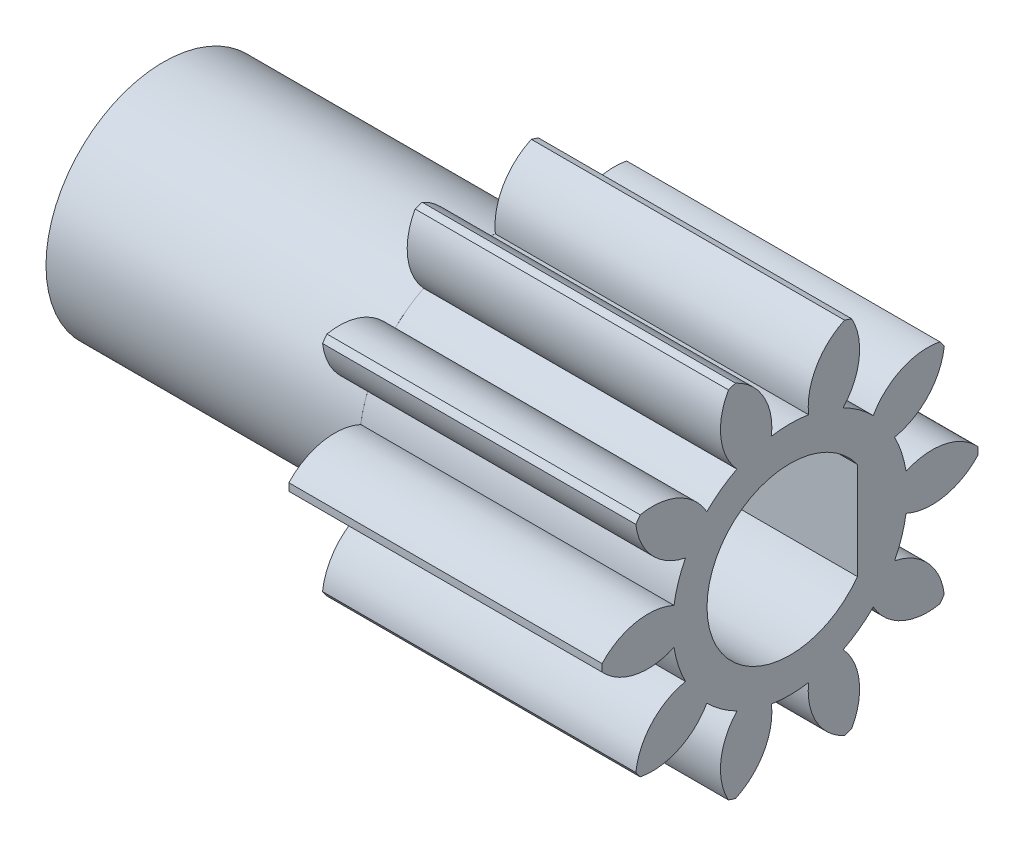
from build123d import *

# Parameters (mm, degrees)
BASPROSKE_W                  = 10
BASPROSKE_H                  = 6
TOOTHCUT_DEPTH               = 14.114877049
TEETHCUTS_COUNT              = 10
TEETHCUTS_ANGLE              = 324
BORSKE_R                     = 0.4
BORE_DEPTH                   = 50.0000508
CROQUIS1_R                   = 3.75
SALIENTE_EXTRUIR1_DEPTH      = 10
TALADRO_DE_MARGEN_PARA_M51_D = 5.3
SALIENTE_EXTRUIR2_DEPTH      = 10


with BuildPart() as part:
    # BasProSke → Base-Revolve (revolve)
    with BuildSketch(Plane(origin=(0, 0, 0), x_dir=(1, 0, 0), z_dir=(0, 1, 0))):
        with Locations((5, 3)):
            Rectangle(BASPROSKE_W, BASPROSKE_H)
    revolve(axis=Axis((-10, 0, 0), (1, 0, 0)))

    # TooCutSke → ToothCut (cut, through all)
    with BuildSketch(Plane(origin=(0, 0, 0), x_dir=(0, 0, -1), z_dir=(1, 0, 0))):
        with BuildLine():
            ThreePointArc((0.59278292, 3.701838653), (0, 3.749), (-0.59278292, 3.701838653))
            ThreePointArc((-0.59278292, 3.701838653), (-0.846593509, 4.924114224), (-1.775771316, 5.757784417))
            ThreePointArc((-1.775771316, 5.757784417), (0, 6.0254), (1.775771316, 5.757784417))
            ThreePointArc((1.775771316, 5.757784417), (0.846593509, 4.924114224), (0.59278292, 3.701838653))
        make_face()
    toothcut = extrude(amount=TOOTHCUT_DEPTH, mode=Mode.SUBTRACT)

    # TeethCuts: ToothCut ×10 about axis
    teethcuts_axis = Axis((-10, 0, 0), (1, 0, 0))
    for i in range(1, TEETHCUTS_COUNT):
        add(toothcut.rotate(teethcuts_axis, i * TEETHCUTS_ANGLE / (TEETHCUTS_COUNT - 1)), mode=Mode.SUBTRACT)

    # BorSke → Bore (cut, symmetric)
    with BuildSketch(Plane(origin=(0, 0, 0), x_dir=(0, 0, -1), z_dir=(1, 0, 0))):
        Circle(BORSKE_R)
    extrude(amount=BORE_DEPTH, both=True, mode=Mode.SUBTRACT)

    # Croquis1 → Saliente-Extruir1 (add)
    with BuildSketch(Plane.ZY):
        Circle(CROQUIS1_R)
    extrude(amount=SALIENTE_EXTRUIR1_DEPTH)

    # Taladro de margen para M51 (through all)
    with Locations(Plane.ZY.offset(10)):
        with Locations((0, 0)):
            Hole(TALADRO_DE_MARGEN_PARA_M51_D / 2)

    # Croquis5 → Saliente-Extruir2 (add)
    with BuildSketch(Plane(origin=(10, 0, 0), x_dir=(0, 0, -1), z_dir=(1, 0, 0))):
        with BuildLine():
            Line((2.149418526, 0), (2.149418526, 1.55))
            ThreePointArc((2.149418526, 1.55), (2.65, 0), (2.149418526, -1.55))
            Line((2.149418526, -1.55), (2.149418526, 0))
        make_face()
    extrude(amount=-SALIENTE_EXTRUIR2_DEPTH)


solid = part.part
